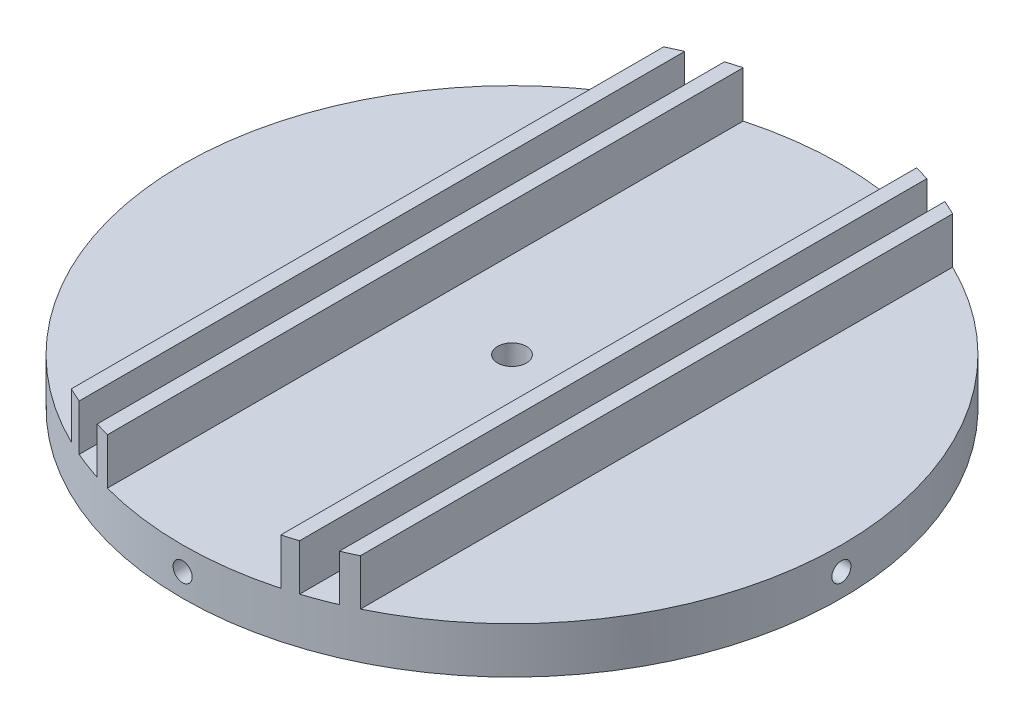
from build123d import *

# Parameters (mm, degrees)
SKETCH1_R           = 57
BOSS_EXTRUDE1_DEPTH = 4
BOSS_EXTRUDE2_START = 8
BOSS_EXTRUDE2_DEPTH = 8
M6_TAPPED_HOLE1_D   = 5


# Read off the part's stored shape, not the designer's step: M4 Tapped Hole1
with BuildPart() as part:
    # Sketch1 → Boss-Extrude1 (new, symmetric)
    with BuildSketch(Plane(origin=(0, 0, 0), x_dir=(1, 0, 0), z_dir=(0, 1, 0))):
        with Locations(Location((0, 0, 0), (0, 0, 270))):
            Circle(SKETCH1_R)
    extrude(amount=BOSS_EXTRUDE1_DEPTH, both=True)

    # Sketch2 → Boss-Extrude2 (add)
    with BuildSketch(Plane(origin=(0, 4, 0), x_dir=(1, 0, 0), z_dir=(0, 1, 0)).offset(BOSS_EXTRUDE2_START)):
        with BuildLine():
            Line((-22.5, -52.37127075), (-22.5, 52.37127075))
            ThreePointArc((-22.5, 52.37127075), (-23.756914523, 51.81321272), (-25, 51.224993899))
            Line((-25, 51.224993899), (-25, -51.224993899))
            ThreePointArc((-25, -51.224993899), (-23.756914523, -51.81321272), (-22.5, -52.37127075))
        make_face()
        with BuildLine():
            ThreePointArc((-15, 54.990908339), (-16.254254993, 54.633315794), (-17.5, 54.247119739))
            Line((-17.5, 54.247119739), (-17.5, -54.247119739))
            ThreePointArc((-17.5, -54.247119739), (-16.254254993, -54.633315794), (-15, -54.990908339))
            Line((-15, -54.990908339), (-15, 54.990908339))
        make_face()
        with BuildLine():
            Line((25, -51.224993899), (25, 51.224993899))
            ThreePointArc((25, 51.224993899), (23.756914523, 51.81321272), (22.5, 52.37127075))
            Line((22.5, 52.37127075), (22.5, -52.37127075))
            ThreePointArc((22.5, -52.37127075), (23.756914523, -51.81321272), (25, -51.224993899))
        make_face()
        with BuildLine():
            ThreePointArc((17.5, 54.247119739), (16.254254993, 54.633315794), (15, 54.990908339))
            Line((15, 54.990908339), (15, -54.990908339))
            ThreePointArc((15, -54.990908339), (16.254254993, -54.633315794), (17.5, -54.247119739))
            Line((17.5, -54.247119739), (17.5, 54.247119739))
        make_face()
    extrude(amount=-BOSS_EXTRUDE2_DEPTH)

    # M6 Tapped Hole1 (through all)
    with Locations(Plane(origin=(0, -4, 0), x_dir=(-1, 0, 0), z_dir=(0, -1, 0))):
        with Locations((0, 0)):
            Hole(M6_TAPPED_HOLE1_D / 2)

    # M4 Tapped Hole1 outline → M4 Tapped Hole1 (revolve, cut)
    with BuildSketch(Plane.XZ):
        Polygon((1.65, -57.000012834), (1.65, -46.9), (0, -45.908579979), (0, -57.000012834), align=None)
        Polygon((0, 57.000003302), (0, 45.908579979), (1.65, 46.9), (1.65, 57.000003302), align=None)
    revolve(axis=Axis((0, 0, 0), (0, 0, 1)), mode=Mode.SUBTRACT)

    # M4 Tapped Hole1 2 outline → M4 Tapped Hole1 2 (revolve, cut)
    with BuildSketch(Plane.YX):
        Polygon((0, 45.908579979), (1.65, 46.9), (1.65, 57.000003302), (0, 57.000003302), align=None)
        Polygon((1.65, -46.9), (0, -45.908579979), (0, -57.000003302), (1.65, -57.000003302), align=None)
    revolve(axis=Axis((0, 0, 0), (1, 0, 0)), mode=Mode.SUBTRACT)


solid = part.part
